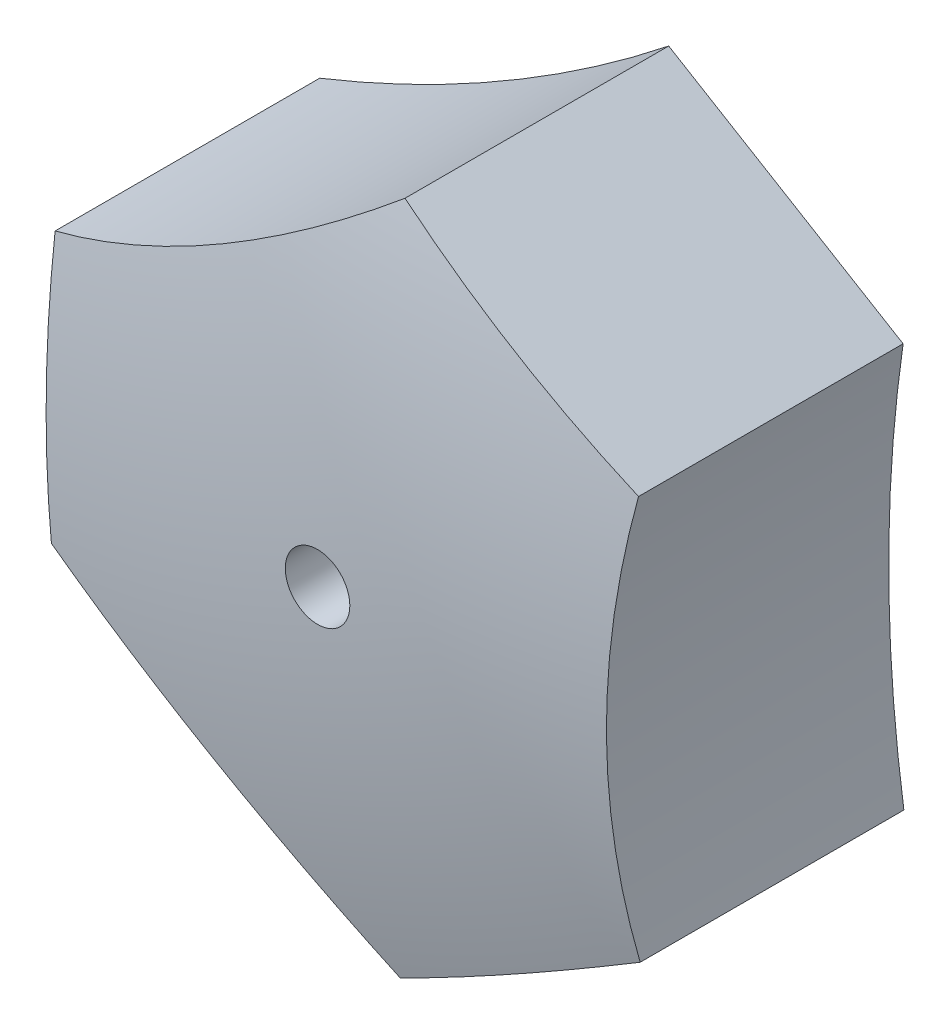
from build123d import *

# Parameters (mm, degrees)
BOSS_EXTRUDE1_DEPTH = 13.75
SKETCH4_R           = 3.05
CUT_EXTRUDE1_DEPTH  = 4
SKETCH5_R           = 1.45
CUT_EXTRUDE2_DEPTH  = 139.272786048


with BuildPart() as part:
    # Boss-Extrude1: read off the stored shape, not the designer's step
    # Boss-Extrude1 outline → Boss-Extrude1 (new body)
    with BuildSketch(Plane.XY):
        with BuildLine():
            Line((-44.963090762, -123.889928328), (-34.25904674, -117.947860363))
            ThreePointArc((-34.25904674, -117.947860363), (-34.937745159, -108.915491102), (-34.292771341, -99.880651048))
            Line((-34.292771341, -99.880651048), (-44.790775161, -93.581710984))
            ThreePointArc((-44.790775161, -93.581710984), (-52.273687189, -98.685665687), (-60.420575103, -102.644522003))
            Line((-60.420575103, -102.644522003), (-60.626615305, -114.885530032))
            ThreePointArc((-60.626615305, -114.885530032), (-52.465004859, -118.81394459), (-44.963090762, -123.889928328))
        make_face()
    extrude(amount=BOSS_EXTRUDE1_DEPTH)

    # Boss-Extrude1 2 outline → Boss-Extrude1 2 (revolve, cut)
    with BuildSketch(Plane(origin=(-46.558812402, -108.805033793, 0), x_dir=(1, 0, 0), z_dir=(0, -1, 0))):
        with BuildLine():
            ThreePointArc((0, 13.75), (7.723984527, 13.263031911), (15.32564925, 11.809839448))
            Line((15.32564925, 11.809839448), (15.32564925, 13.75))
            Line((15.32564925, 13.75), (0, 13.75))
        make_face()
    revolve(axis=Axis((-46.558812402, -108.805033793, 0), (0, 0, 1)), mode=Mode.SUBTRACT)

    # Sketch4 → Cut-Extrude1 (cut)
    with BuildSketch(Plane(origin=(0, 0, 0), x_dir=(-1, 0, 0), z_dir=(0, 0, -1))):
        with Locations((46.784528167, -108.691568131)):
            Circle(SKETCH4_R)
    extrude(amount=-CUT_EXTRUDE1_DEPTH, mode=Mode.SUBTRACT)

    # Sketch5 → Cut-Extrude2 (cut, through all)
    with BuildSketch(Plane(origin=(0, 0, 4), x_dir=(-1, 0, 0), z_dir=(0, 0, -1))):
        with Locations((46.784528167, -108.691568131)):
            Circle(SKETCH5_R)
    extrude(amount=-CUT_EXTRUDE2_DEPTH, mode=Mode.SUBTRACT)


solid = part.part
